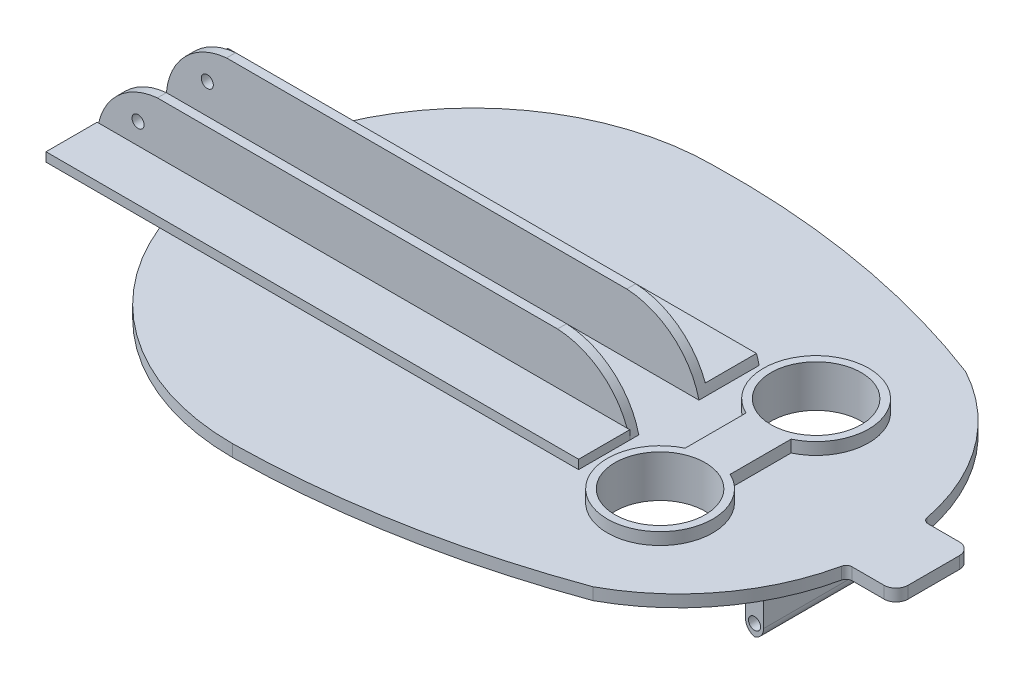
from build123d import *

# Parameters (mm, degrees)
BOSS_EXTRUDE1_DEPTH      = 4
BOSS_EXTRUDE2_DEPTH      = 4
BOSS_EXTRUDE2_DEPTH_BACK = 10
SKETCH2_R                = 15
CUT_EXTRUDE1_START       = -40
SKETCH3_R                = 15
CUT_EXTRUDE1_DEPTH       = 40
SKETCH4_W                = 6
SKETCH4_H                = 50
BOSS_EXTRUDE3_DEPTH      = 20
SKETCH5_R                = 2
CUT_EXTRUDE2_DEPTH       = 59
FILLET1_R                = 4
BOSS_EXTRUDE4_DEPTH      = 177
BOSS_EXTRUDE4_2_DEPTH    = 177
CUT_EXTRUDE3_DEPTH       = 48
SKETCH8_R                = 2
CUT_EXTRUDE4_DEPTH       = 48


with BuildPart() as part:
    # Sketch1 → Boss-Extrude1 (new body)
    with BuildSketch(Plane(origin=(0, 0, 0), x_dir=(1, 0, 0), z_dir=(0, 1, 0))):
        with BuildLine():
            Line((110.657779677, 12.5), (121, 12.5))
            ThreePointArc((121, 12.5), (123.828427125, 11.328427125), (125, 8.5))
            Line((125, 8.5), (125, -8.5))
            ThreePointArc((125, -8.5), (123.828427125, -11.328427125), (121, -12.5))
            Line((121, -12.5), (110.401806797, -12.5))
            ThreePointArc((110.401806797, -12.5), (109.144019868, -12.945017028), (108.445969541, -14.082027957))
            ThreePointArc((108.445969541, -14.082027957), (95.944653725, -41.573721876), (73.071805054, -61.29449583))
            ThreePointArc((73.071805054, -61.29449583), (23.283379571, -74.88735697), (-28.073353846, -80))
            ThreePointArc((-28.073353846, -80), (-108.073353846, 0), (-28.073353846, 80))
            ThreePointArc((-28.073353846, 80), (23.354156646, 76.227477824), (73.071805054, 62.546242656))
            ThreePointArc((73.071805054, 62.546242656), (96.314926426, 42.326708807), (108.694869144, 14.116617376))
            ThreePointArc((108.694869144, 14.116617376), (109.386316986, 12.956179213), (110.657779677, 12.5))
        make_face()
    extrude(amount=BOSS_EXTRUDE1_DEPTH)

    # Sketch2 → Boss-Extrude2 (add, two sides: drawn at the far end of the back side and taken through both)
    with BuildSketch(Plane(origin=(0, 4, 0), x_dir=(1, 0, 0), z_dir=(0, 1, 0)).offset(-BOSS_EXTRUDE2_DEPTH_BACK)):
        with BuildLine():
            Line((67.5, 10.115173029), (67.5, -10.115173029))
            ThreePointArc((67.5, -10.115173029), (60, -43.42656133), (52.5, -10.115173029))
            Line((52.5, -10.115173029), (52.5, 10.115173029))
            ThreePointArc((52.5, 10.115173029), (60, 43.42656133), (67.5, 10.115173029))
        make_face()
        with Locations(Location((60, 25.92656133, 0), (0, 0, 270))):
            Circle(SKETCH2_R, mode=Mode.SUBTRACT)
        with Locations(Location((60, -25.92656133, 0), (0, 0, 270))):
            Circle(SKETCH2_R, mode=Mode.SUBTRACT)
    extrude(amount=BOSS_EXTRUDE2_DEPTH + BOSS_EXTRUDE2_DEPTH_BACK)

    # Sketch3 → Cut-Extrude1 (cut)
    with BuildSketch(Plane(origin=(0, 4, 0), x_dir=(1, 0, 0), z_dir=(0, 1, 0)).offset(CUT_EXTRUDE1_START)):
        with Locations(Location((60, 25.92656133, 0), (0, 0, 270))):
            Circle(SKETCH3_R)
        with Locations(Location((60, -25.92656133, 0), (0, 0, 270))):
            Circle(SKETCH3_R)
    extrude(amount=CUT_EXTRUDE1_DEPTH, mode=Mode.SUBTRACT)

    # Sketch4 → Boss-Extrude3 (add)
    with BuildSketch(Plane.XZ):
        with Locations((90.461255122, 0)):
            Rectangle(SKETCH4_W, SKETCH4_H)
    extrude(amount=BOSS_EXTRUDE3_DEPTH)

    # Sketch5 → Cut-Extrude2 (cut)
    with BuildSketch(Plane.XY.offset(25)):
        with Locations((90.461255122, -16)):
            Circle(SKETCH5_R)
    extrude(amount=-CUT_EXTRUDE2_DEPTH, mode=Mode.SUBTRACT)

    # Fillet1
    # the kernel refuses this fillet: 4 mm, written as the material it takes off along each edge
    with BuildSketch(Plane(origin=(87.461255122, -20, 35), x_dir=(0, 1, 0), z_dir=(0, 0, -1)), Plane(origin=(93.461255122, -20, -35), x_dir=(0, 1, 0), z_dir=(0, 0, 1))) as fillet1_piece_1:
        with BuildLine():
            CenterArc((FILLET1_R, FILLET1_R), FILLET1_R, 180, 90)
            Line((0, FILLET1_R), (0, 0))
            Line((0, 0), (FILLET1_R, 0))
        make_face()
    extrude(amount=70, mode=Mode.SUBTRACT)


with BuildPart() as body_2:
    # Sketch6 → Boss-Extrude4 (new body)
    with BuildSketch(Plane(origin=(-140, 0, 0), x_dir=(0, 0, -1), z_dir=(1, 0, 0))):
        Polygon((-10, 24.014870056), (-10, 4.014870056), (-30, 4.014870056), (-30, 7.014870056), (-13, 7.014870056), (-13, 24.014870056), align=None)
    extrude(amount=BOSS_EXTRUDE4_DEPTH)


with BuildPart() as body_3:
    # Sketch6 → Boss-Extrude4 2 (new body)
    with BuildSketch(Plane(origin=(-140, 0, 0), x_dir=(0, 0, -1), z_dir=(1, 0, 0))):
        Polygon((10, 4.014870056), (30, 4.014870056), (30, 7.014870056), (13, 7.014870056), (13, 24.014870056), (10, 24.014870056), align=None)
    extrude(amount=BOSS_EXTRUDE4_2_DEPTH)


with BuildPart() as cut_extrude3_tool:
    # Sketch7 → Cut-Extrude3 (new body)
    with BuildSketch(Plane.XY.offset(13)):
        with BuildLine():
            Line((-140, 4.014870056), (-157.204632891, 4.014870056))
            Line((-157.204632891, 4.014870056), (-157.204632891, 69.663606964))
            Line((-157.204632891, 69.663606964), (45.151142149, 69.663606964))
            Line((45.151142149, 69.663606964), (37, 4.014870056))
            ThreePointArc((37, 4.014870056), (27.360000088, 18.8152233), (10.479723785, 24.014870056))
            Line((10.479723785, 24.014870056), (10.479723785, 49.759760239))
            Line((10.479723785, 49.759760239), (-96.940208084, 49.759760239))
            Line((-96.940208084, 49.759760239), (-116.097630779, 24.014870056))
            ThreePointArc((-116.097630779, 24.014870056), (-132.190951013, 18.965212808), (-140, 4.014870056))
        make_face()
    extrude(amount=-CUT_EXTRUDE3_DEPTH)


with BuildPart() as body_2_1:
    add(body_2.part)

    # Cut-Extrude3: cut by cut_extrude3_tool
    add(cut_extrude3_tool.part, mode=Mode.SUBTRACT)


with BuildPart() as body_3_1:
    add(body_3.part)

    # Cut-Extrude3: cut by cut_extrude3_tool
    add(cut_extrude3_tool.part, mode=Mode.SUBTRACT)


with BuildPart() as cut_extrude4_tool:
    # Sketch8 → Cut-Extrude4 (new body)
    with BuildSketch(Plane.XY.offset(13)):
        with Locations((-126.398152124, 14.014870056)):
            Circle(SKETCH8_R)
    extrude(amount=-CUT_EXTRUDE4_DEPTH)


with BuildPart() as body_2_2:
    add(body_2_1.part)

    # Cut-Extrude4: cut by cut_extrude4_tool
    add(cut_extrude4_tool.part, mode=Mode.SUBTRACT)


with BuildPart() as body_3_2:
    add(body_3_1.part)

    # Cut-Extrude4: cut by cut_extrude4_tool
    add(cut_extrude4_tool.part, mode=Mode.SUBTRACT)


solid = Compound([part.part, body_2_2.part, body_3_2.part])
